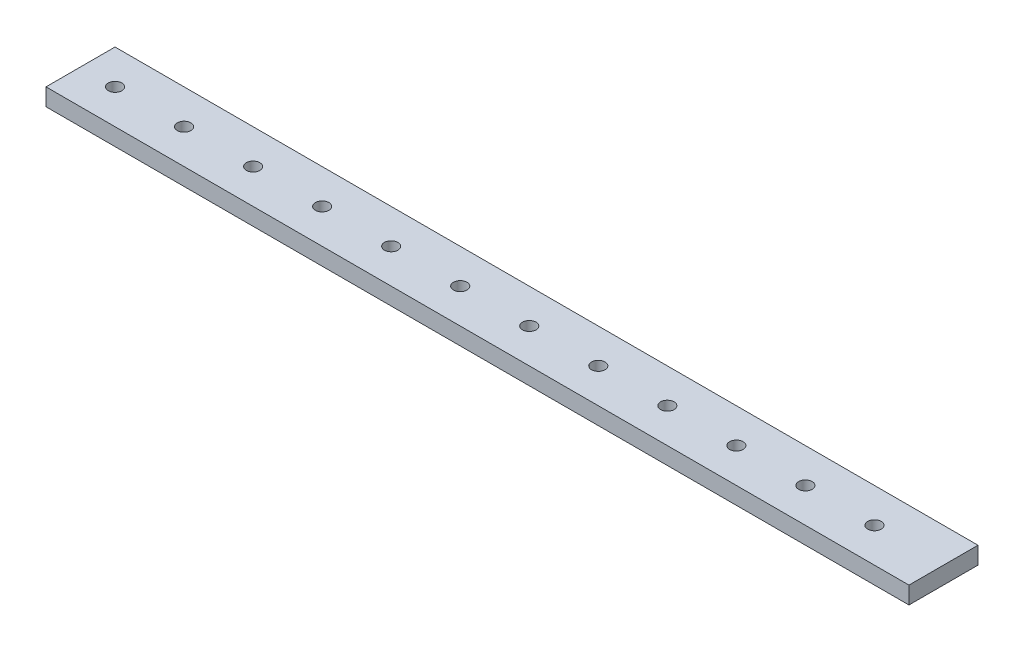
from build123d import *

# Parameters (mm, degrees)
SKETCH1_W               = 317.5
SKETCH1_H               = 25.4
BOSS_EXTRUDE1_DEPTH     = 6.35
CUT_EXTRUDE1_DEPTH      = 319.577671063
CUT_EXTRUDE1_DEPTH_BACK = 319.577671063
SKETCH2_R               = 2.4892


with BuildPart() as part:
    # Sketch1 → Boss-Extrude1 (new body)
    with BuildSketch(Plane(origin=(0, 0, 0), x_dir=(1, 0, 0), z_dir=(0, 1, 0))):
        with Locations((158.75, 12.7)):
            Rectangle(SKETCH1_W, SKETCH1_H)
    extrude(amount=BOSS_EXTRUDE1_DEPTH)

    # Sketch2 → Cut-Extrude1 (cut, two sides: drawn at the far end of the back side and taken through both)
    with BuildSketch(Plane(origin=(0, 6.35, 0), x_dir=(1, 0, 0), z_dir=(0, 1, 0)).offset(-CUT_EXTRUDE1_DEPTH_BACK)):
        with Locations((292.1, 12.7)):
            Circle(SKETCH2_R)
        with Locations((266.7, 12.7)):
            Circle(SKETCH2_R)
        with Locations((241.3, 12.7)):
            Circle(SKETCH2_R)
        with Locations((215.9, 12.7)):
            Circle(SKETCH2_R)
        with Locations((190.5, 12.7)):
            Circle(SKETCH2_R)
        with Locations((165.1, 12.7)):
            Circle(SKETCH2_R)
        with Locations((139.7, 12.7)):
            Circle(SKETCH2_R)
        with Locations((114.3, 12.7)):
            Circle(SKETCH2_R)
        with Locations((88.9, 12.7)):
            Circle(SKETCH2_R)
        with Locations((63.5, 12.7)):
            Circle(SKETCH2_R)
        with Locations((38.1, 12.7)):
            Circle(SKETCH2_R)
        with Locations((12.7, 12.7)):
            Circle(SKETCH2_R)
    extrude(amount=CUT_EXTRUDE1_DEPTH + CUT_EXTRUDE1_DEPTH_BACK, mode=Mode.SUBTRACT)


solid = part.part
